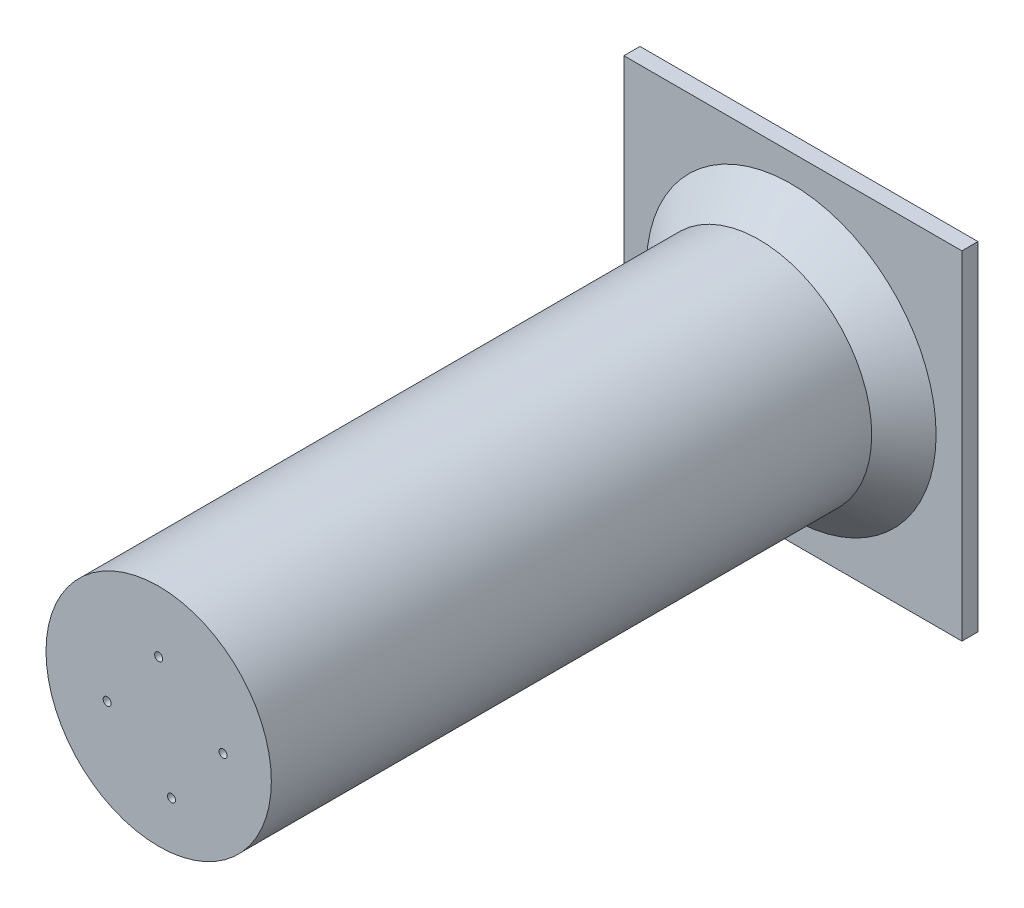
from build123d import *

# Parameters (mm, degrees)
CROQUIS1_W                  = 248.76
CROQUIS1_H                  = 195
SALIENTE_EXTRUIR1_DEPTH     = 5
CROQUIS2_W                  = 48
CROQUIS2_H                  = 30
CROQUIS2_W_2                = 30
CORTAR_EXTRUIR1_DEPTH       = 2
CROQUIS3_R                  = 2.375
CORTAR_EXTRUIR2_DEPTH       = 10
CROQUIS4_R                  = 35
SALIENTE_EXTRUIR2_DEPTH     = 196.5
CROQUIS5_R                  = 12.5
CORTAR_EXTRUIR3_DEPTH       = 10
CROQUIS12_W                 = 12
CROQUIS12_H                 = 30
SALIENTE_EXTRUIR3_DEPTH     = 4
REDONDEO1_R                 = 10
REDONDEO2_R                 = 10
REDONDEO3_R                 = 10
CORTAR_EXTRUIR5_DEPTH       = 255.266033949
CORTAR_EXTRUIR5_DEPTH_BACK  = 255.266033949
CROQUIS13_R                 = 1.625
CORTAR_EXTRUIR7_DEPTH       = 2
CROQUIS16_R                 = 1.25
CORTAR_EXTRUIR9_DEPTH       = 20
CORTAR_EXTRUIR17_DEPTH      = 307.465597013
CORTAR_EXTRUIR17_DEPTH_BACK = 307.465597013
CROQUIS21_W                 = 105
CROQUIS21_H                 = 105
SALIENTE_EXTRUIR4_DEPTH     = 5
CHAFL_N1_SIZE               = 10


with BuildPart() as part:
    # Croquis1 → Saliente-Extruir1 (new body)
    with BuildSketch(Plane.XY):
        with Locations((7.088293187, 0.26268)):
            Rectangle(CROQUIS1_W, CROQUIS1_H)
    extrude(amount=SALIENTE_EXTRUIR1_DEPTH)

    # Croquis2 → Cortar-Extruir1 (cut)
    with BuildSketch(Plane.XY.offset(5)):
        with Locations((-93.291706813, -82.23732)):
            Rectangle(CROQUIS2_W, CROQUIS2_H)
        with Locations((116.468293187, 82.76268)):
            Rectangle(CROQUIS2_W_2, CROQUIS2_H)
        with Locations((116.468293187, -82.23732)):
            Rectangle(CROQUIS2_W_2, CROQUIS2_H)
        with Locations((-93.291706813, 82.76268)):
            Rectangle(CROQUIS2_W, CROQUIS2_H)
    extrude(amount=-CORTAR_EXTRUIR1_DEPTH, mode=Mode.SUBTRACT)

    # Croquis3 → Cortar-Extruir2 (cut)
    with BuildSketch(Plane.XY.offset(5)):
        with Locations((-93.291706813, 83.76268)):
            Circle(CROQUIS3_R)
        with Locations((-93.291706813, -83.23732)):
            Circle(CROQUIS3_R)
        with Locations((116.468293187, 83.76268)):
            Circle(CROQUIS3_R)
        with Locations((116.468293187, -83.23732)):
            Circle(CROQUIS3_R)
    extrude(amount=-CORTAR_EXTRUIR2_DEPTH, mode=Mode.SUBTRACT)

    # Croquis4 → Saliente-Extruir2 (add)
    with BuildSketch(Plane(origin=(0, 0, 0), x_dir=(-1, 0, 0), z_dir=(0, 0, -1))):
        with Locations((55.101706813, 0.26268)):
            Circle(CROQUIS4_R)
    extrude(amount=SALIENTE_EXTRUIR2_DEPTH)

    # Croquis5 → Cortar-Extruir3 (cut)
    with BuildSketch(Plane(origin=(0, 0, 0), x_dir=(-1, 0, 0), z_dir=(0, 0, -1))):
        with Locations((-76.968293187, 0.26268)):
            Circle(CROQUIS5_R)
    extrude(amount=-CORTAR_EXTRUIR3_DEPTH, mode=Mode.SUBTRACT)

    # Croquis12 → Saliente-Extruir3 (add, symmetric)
    with BuildSketch(Plane(origin=(7.088293187, 0, 0), x_dir=(0, 0, -1), z_dir=(1, 0, 0))):
        with Locations((6, 82.76268)):
            Rectangle(CROQUIS12_W, CROQUIS12_H)
        with Locations((6, -82.23732)):
            Rectangle(CROQUIS12_W, CROQUIS12_H)
    extrude(amount=SALIENTE_EXTRUIR3_DEPTH, both=True)

    # Redondeo1
    redondeo1_edges = [part.edges().sort_by_distance(p)[0] for p in [
        (7.088293187, -67.23732, 0),
        (7.088293187, 67.76268, 0),
    ]]
    fillet(redondeo1_edges, radius=REDONDEO1_R)

    # Redondeo2
    redondeo2_edges = [part.edges().sort_by_distance(p)[0] for p in [
        (7.088293187, 67.76268, -12),
        (7.088293187, -67.23732, -12),
    ]]
    fillet(redondeo2_edges, radius=REDONDEO2_R)

    # Redondeo3
    redondeo3_edges = [part.edges().sort_by_distance(p)[0] for p in [
        (7.088293187, -97.23732, -12),
        (7.088293187, 97.76268, -12),
    ]]
    fillet(redondeo3_edges, radius=REDONDEO3_R)

    # Croquis13 → Cortar-Extruir5 (cut, two sides: drawn at the far end of the back side and taken through both)
    with BuildSketch(Plane(origin=(11.088293187, 0, 0), x_dir=(0, 0, -1), z_dir=(1, 0, 0)).offset(-CORTAR_EXTRUIR5_DEPTH_BACK)):
        with Locations((6, 87.76268)):
            Circle(CROQUIS13_R)
        with Locations((6, 77.76268)):
            Circle(CROQUIS13_R)
        with Locations((6, -77.23732)):
            Circle(CROQUIS13_R)
        with Locations((6, -87.23732)):
            Circle(CROQUIS13_R)
    extrude(amount=CORTAR_EXTRUIR5_DEPTH + CORTAR_EXTRUIR5_DEPTH_BACK, mode=Mode.SUBTRACT)

    # Croquis15 → Cortar-Extruir7 (cut)
    with BuildSketch(Plane.XY.offset(5)):
        Polygon((111.468293187, 67.76268), (131.468293187, 67.76268), (131.468293187, -67.23732), (111.468293187, -67.23732), (111.468293187, -59.48732), (125.218293187, -59.48732), (125.218293187, 60.01268), (111.468293187, 60.01268), align=None)
    extrude(amount=-CORTAR_EXTRUIR7_DEPTH, mode=Mode.SUBTRACT)

    # Croquis16 → Cortar-Extruir9 (cut)
    with BuildSketch(Plane.XY.offset(5)):
        with Locations((-55.101706813, 16.26268)):
            Circle(CROQUIS16_R)
        with Locations((-35.101706813, 0.26268)):
            Circle(CROQUIS16_R)
        with Locations((-51.101706813, -19.73732)):
            Circle(CROQUIS16_R)
        with Locations((-71.101706813, -3.73732)):
            Circle(CROQUIS16_R)
    extrude(amount=-CORTAR_EXTRUIR9_DEPTH, mode=Mode.SUBTRACT)

    # Croquis20 → Cortar-Extruir17 (cut, two sides: drawn at the far end of the back side and taken through both)
    with BuildSketch(Plane.XZ.offset(97.23732).offset(-CORTAR_EXTRUIR17_DEPTH_BACK)):
        Polygon((-117.291706813, 10.531534682), (-117.291706813, 0), (3.088293187, 0), (3.088293187, -12), (11.088293187, -12), (11.088293187, 0), (131.468293187, 0), (131.468293187, 10.531534682), align=None)
    extrude(amount=CORTAR_EXTRUIR17_DEPTH + CORTAR_EXTRUIR17_DEPTH_BACK, mode=Mode.SUBTRACT)

    # Croquis21 → Saliente-Extruir4 (add)
    with BuildSketch(Plane(origin=(0, 0, -196.5), x_dir=(-1, 0, 0), z_dir=(0, 0, -1))):
        with Locations((54.583486428, 1.233156347)):
            Rectangle(CROQUIS21_W, CROQUIS21_H)
    extrude(amount=SALIENTE_EXTRUIR4_DEPTH)

    # Chaflán1
    chafl_n1_edges = [part.edges().sort_by_distance(p)[0] for p in [
        (-20.101706813, 0.26268, -196.5),
    ]]
    chamfer(chafl_n1_edges, length=CHAFL_N1_SIZE)


solid = part.part
